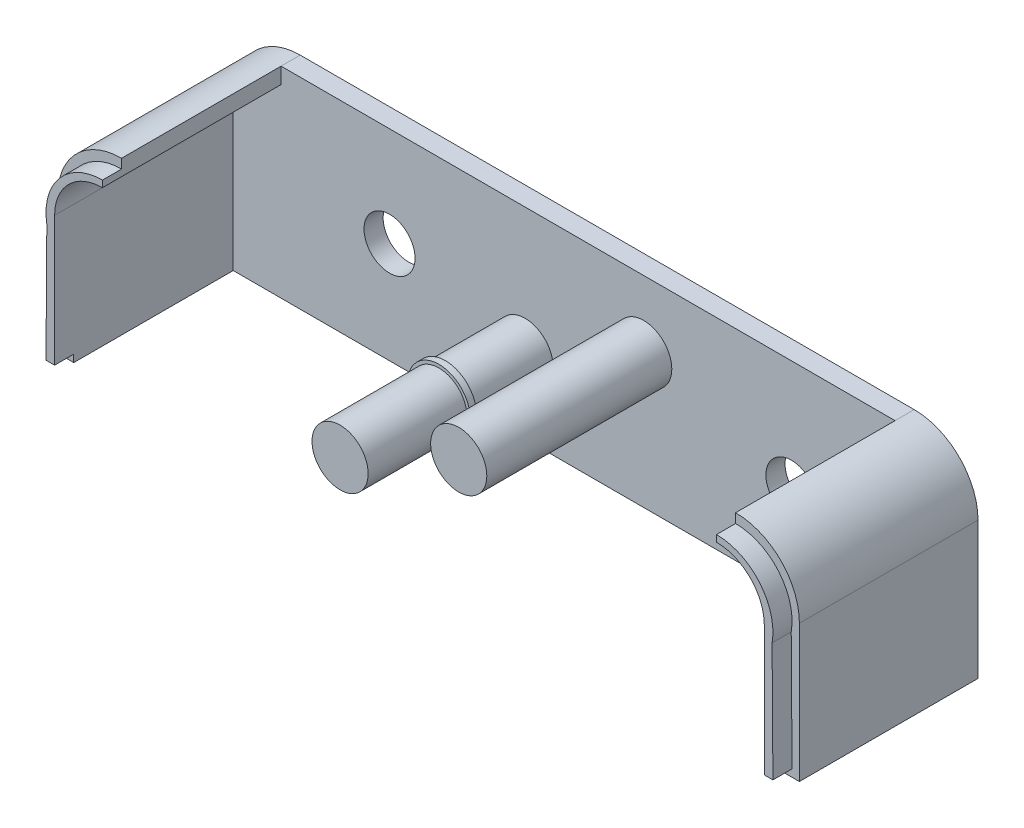
from build123d import *

# Parameters (mm, degrees)
SKETCH1_R           = 4
BOSS_EXTRUDE2_DEPTH = 3
SKETCH2_R           = 4.4
BOSS_EXTRUDE3_DEPTH = 25
CUT_EXTRUDE3_START  = -1
SKETCH10_R          = 4.4
CUT_EXTRUDE3_DEPTH  = 1
BOSS_EXTRUDE5_DEPTH = 3
SKETCH12_R          = 4.4
BOSS_EXTRUDE6_DEPTH = 5
SKETCH14_R          = 4.9
BOSS_EXTRUDE7_DEPTH = 1


with BuildPart() as part:
    # Sketch1 → Boss-Extrude2 (new body)
    with BuildSketch(Plane.XY):
        with BuildLine():
            Line((-48.125, 15.75), (48.125, 15.75))
            ThreePointArc((48.125, 15.75), (55.196067812, 12.821067812), (58.125, 5.75))
            Line((58.125, 5.75), (58.125, -15.75))
            Line((58.125, -15.75), (-58.125, -15.75))
            Line((-58.125, -15.75), (-58.125, 5.75))
            ThreePointArc((-58.125, 5.75), (-55.196067812, 12.821067812), (-48.125, 15.75))
        make_face()
        with Locations((31.875, -1.75)):
            Circle(SKETCH1_R, mode=Mode.SUBTRACT)
        with Locations((-31.125, 0.15)):
            Circle(SKETCH1_R, mode=Mode.SUBTRACT)
    extrude(amount=BOSS_EXTRUDE2_DEPTH)

    # Sketch2 → Boss-Extrude3 (add)
    with BuildSketch(Plane.XY.offset(3)):
        with BuildLine():
            Line((55.625, 5.75), (55.625, -15.75))
            Line((55.625, -15.75), (58.125, -15.75))
            Line((58.125, -15.75), (58.125, 5.75))
            ThreePointArc((58.125, 5.75), (55.196067812, 12.821067812), (48.125, 15.75))
            Line((48.125, 15.75), (48.125, 13.25))
            ThreePointArc((48.125, 13.25), (53.428300859, 11.053300859), (55.625, 5.75))
        make_face()
        with BuildLine():
            Line((-58.125, -15.75), (-55.625, -15.75))
            Line((-55.625, -15.75), (-55.625, 5.75))
            ThreePointArc((-55.625, 5.75), (-53.428300859, 11.053300859), (-48.125, 13.25))
            Line((-48.125, 13.25), (-48.125, 15.75))
            ThreePointArc((-48.125, 15.75), (-55.196067812, 12.821067812), (-58.125, 5.75))
            Line((-58.125, 5.75), (-58.125, -15.75))
        make_face()
        with Locations((8.725, 5.25)):
            Circle(SKETCH2_R)
        with Locations((-9.875, -3.75)):
            Circle(SKETCH2_R)
    extrude(amount=BOSS_EXTRUDE3_DEPTH)

    # Sketch10 → Cut-Extrude3 (cut)
    with BuildSketch(Plane.XY.offset(28).offset(CUT_EXTRUDE3_START)):
        with Locations((8.725, 5.25)):
            Circle(SKETCH10_R)
        with Locations((-9.875, -3.75)):
            Circle(SKETCH10_R)
    extrude(amount=CUT_EXTRUDE3_DEPTH, mode=Mode.SUBTRACT)

    # Sketch5 → Boss-Extrude5 (add)
    with BuildSketch(Plane.XY.offset(28)):
        with BuildLine():
            Line((-56.84687889, 3.934747007), (-56.975, -14.6))
            Line((-56.975, -14.6), (-55.625, -14.6))
            Line((-55.625, -14.6), (-55.625, 5.75))
            ThreePointArc((-55.625, 5.75), (-53.428300859, 11.053300859), (-48.125, 13.25))
            Line((-48.125, 13.25), (-48.125, 14.285189819))
            ThreePointArc((-48.125, 14.285189819), (-54.892622141, 11.137977782), (-56.84687889, 3.934747007))
        make_face()
        with BuildLine():
            Line((55.625, -14.6), (55.625, 5.75))
            ThreePointArc((55.625, 5.75), (53.428300859, 11.053300859), (48.125, 13.25))
            Line((48.125, 13.25), (48.125, 14.285189819))
            ThreePointArc((48.125, 14.285189819), (54.892622141, 11.137977782), (56.84687889, 3.934747007))
            Line((56.84687889, 3.934747007), (56.975, -14.6))
            Line((56.975, -14.6), (55.625, -14.6))
        make_face()
    extrude(amount=BOSS_EXTRUDE5_DEPTH)

    # Sketch12 → Boss-Extrude6 (add)
    with BuildSketch(Plane.XY.offset(27)):
        with Locations((-9.875, -3.75)):
            Circle(SKETCH12_R)
        with Locations((8.725, 5.25)):
            Circle(SKETCH12_R)
    extrude(amount=BOSS_EXTRUDE6_DEPTH)

    # Sketch14 → Boss-Extrude7 (add)
    with BuildSketch(Plane.XY.offset(15.5)):
        with Locations((-9.875, -3.75)):
            Circle(SKETCH14_R)
    extrude(amount=BOSS_EXTRUDE7_DEPTH)


solid = part.part
